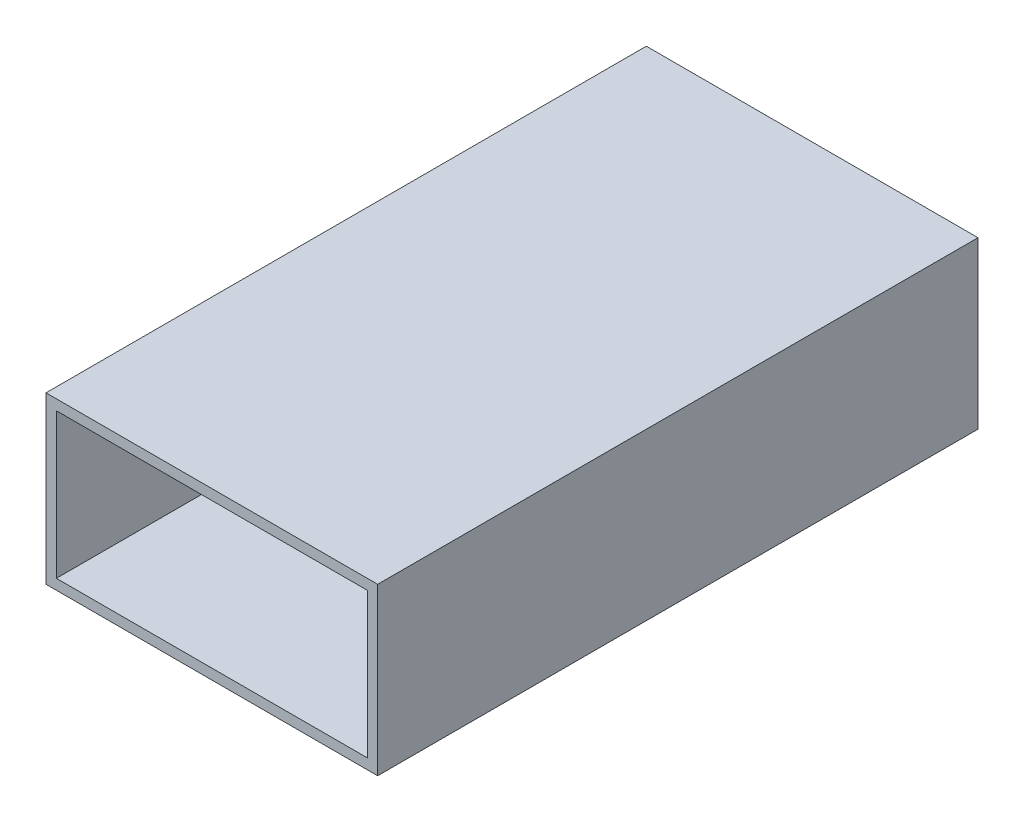
from build123d import *

# Parameters (mm, degrees)
SKETCH1_W           = 50.8
SKETCH1_H           = 25.4
SKETCH1_W_2         = 47.625
SKETCH1_H_2         = 22.225
BOSS_EXTRUDE1_DEPTH = 45.974


with BuildPart() as part:
    # Sketch1 → Boss-Extrude1 (new, symmetric)
    with BuildSketch(Plane.XY):
        Rectangle(SKETCH1_W, SKETCH1_H)
        Rectangle(SKETCH1_W_2, SKETCH1_H_2, mode=Mode.SUBTRACT)
    extrude(amount=BOSS_EXTRUDE1_DEPTH, both=True)


solid = part.part
